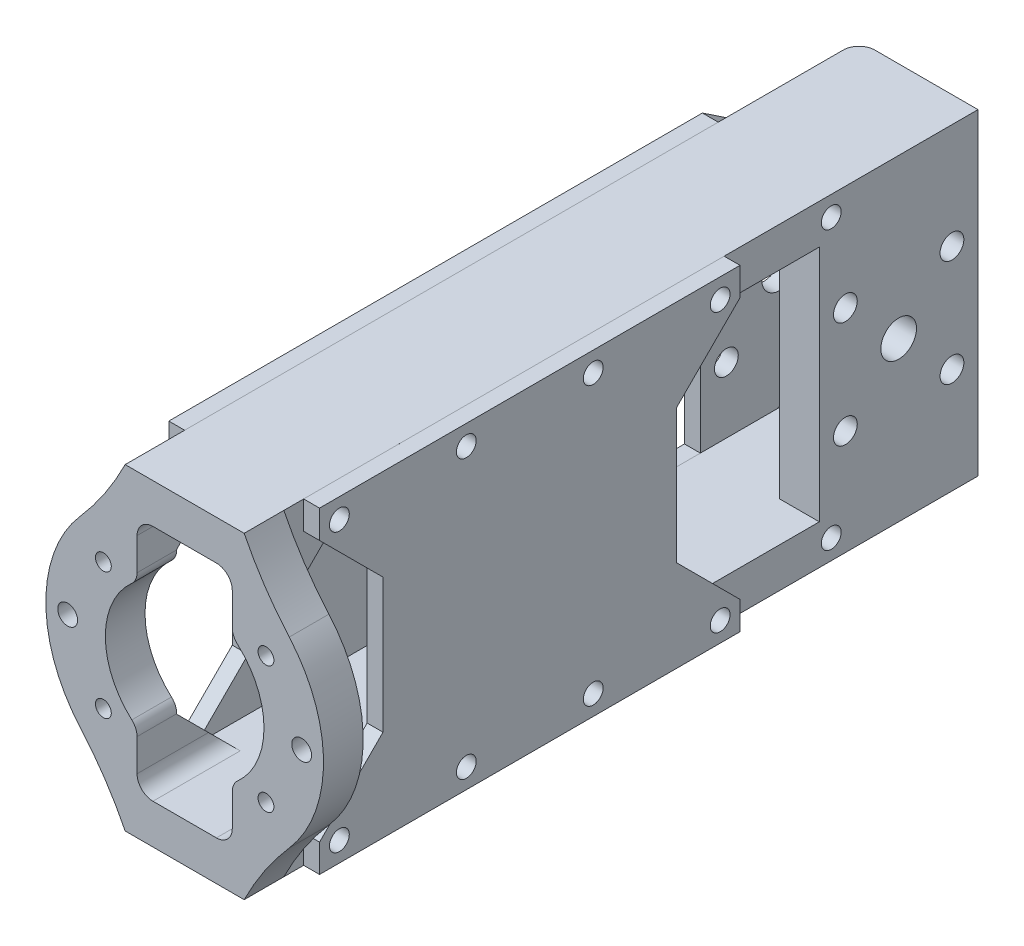
from build123d import *

# Parameters (mm, degrees)
SKETCH_1_R               = 1
SKETCH_1_R_2             = 1.25
SKETCH_1_R_3             = 10
EXTRUDE_1_DEPTH          = 5
EXTRUDE_2_DEPTH          = 7.5
FILLET_2_R               = 40
SKETCH_9_W               = 12
SKETCH_9_H               = 7
CUT_EXTRUDE_2_DEPTH      = 45
FILLET_1_R               = 2
EXTRUDE_START            = 7.5
SKETCH_10_W              = 20
SKETCH_10_H              = 30
SKETCH_10_R              = 1.5
SKETCH_10_R_2            = 2.25
EXTRUDE_3_DEPTH          = 5
CUT_EXTRUDE_3_DEPTH      = 94.173225768
CUT_EXTRUDE_3_DEPTH_BACK = 94.173225768
SKETCH_12_R              = 1.25
SKETCH_13_R              = 1.25
EXTRUDE_4_DEPTH          = 2
EXTRUDE_START_2          = -7.5
SKETCH_14_R              = 1.5
SKETCH_14_R_2            = 2.25
SKETCH_14_R_3            = 1.25
EXTRUDE_5_DEPTH          = 2


with BuildPart() as part:
    # 草图1 → 凸台-拉伸1 (new body)
    # profile 1 of 3: a face of its own
    with BuildSketch(Plane.XY):
        with BuildLine():
            ThreePointArc((7.5, 15.811388301), (0, 17.5), (-7.5, 15.811388301))
            ThreePointArc((-7.5, 15.811388301), (-17.5, 0), (-7.5, -15.811388301))
            ThreePointArc((-7.5, -15.811388301), (0, -17.5), (7.5, -15.811388301))
            ThreePointArc((7.5, -15.811388301), (14.790199458, -9.354143467), (17.5, 0))
            ThreePointArc((17.5, 0), (14.790199458, 9.354143467), (7.5, 15.811388301))
        make_face()
        with Locations((-10.25, -8)):
            Circle(SKETCH_1_R, mode=Mode.SUBTRACT)
        with Locations((10.25, -8)):
            Circle(SKETCH_1_R, mode=Mode.SUBTRACT)
        with Locations((-14.75, 0)):
            Circle(SKETCH_1_R_2, mode=Mode.SUBTRACT)
        with Locations((-10.25, 8)):
            Circle(SKETCH_1_R, mode=Mode.SUBTRACT)
        Circle(SKETCH_1_R_3, mode=Mode.SUBTRACT)
        with Locations((14.75, 0)):
            Circle(SKETCH_1_R_2, mode=Mode.SUBTRACT)
        with Locations((10.25, 8)):
            Circle(SKETCH_1_R, mode=Mode.SUBTRACT)
    # profile 2 of 3: a face of its own
    with BuildSketch(Plane.XY):
        with BuildLine():
            Line((-7.5, 20), (-7.5, 15.811388301))
            ThreePointArc((-7.5, 15.811388301), (0, 17.5), (7.5, 15.811388301))
            Line((7.5, 15.811388301), (7.5, 20))
            Line((7.5, 20), (-7.5, 20))
        make_face()
    # profile 3 of 3: a face of its own
    with BuildSketch(Plane.XY):
        with BuildLine():
            ThreePointArc((7.5, -15.811388301), (0, -17.5), (-7.5, -15.811388301))
            Line((-7.5, -15.811388301), (-7.5, -20))
            Line((-7.5, -20), (7.5, -20))
            Line((7.5, -20), (7.5, -15.811388301))
        make_face()
    extrude(amount=EXTRUDE_1_DEPTH)

    # 草图3 → 凸台-拉伸2 (add, symmetric)
    with BuildSketch(Plane(origin=(0, 0, 0), x_dir=(0, 0, -1), z_dir=(1, 0, 0))):
        Polygon((0, 20), (87.5, 20), (87.5, 15), (6, 15), (0, 9), align=None)
    extrude_2 = extrude(amount=EXTRUDE_2_DEPTH, both=True)

    # 镜向2: 凸台-拉伸2 across plane
    add(extrude_2.mirror(Plane.ZX))

    # 圆角2
    # the kernel refuses this fillet: 40 mm, written as the material it adds along each edge
    with BuildSketch(Plane(origin=(-7.5, 15.811388301, 0), x_dir=(-0.7973311529279393, -0.6035420719142974, 0), z_dir=(0, 0, 1)), Plane(origin=(7.5, -15.811388301, 0), x_dir=(0.79733115292794, 0.6035420719142967, 0), z_dir=(0, 0, 1))) as fillet_2_piece_1:
        with BuildLine():
            CenterArc((15.269376034, -39.162235435), FILLET_2_R, 101.747069775, 14.672077465)
            Line((-2.528003383, -3.339710595), (0, 0))
            ThreePointArc((0, 0), (3.562854408, -0.366521997), (7.125708816, 0))
        make_face()
    extrude(amount=5)
    with BuildSketch(Plane(origin=(7.5, 15.811388301, 0), x_dir=(0, 1, 0), z_dir=(0, 0, 1))) as fillet_2_piece_2:
        with BuildLine():
            CenterArc((22.009559482, -35.810805913), FILLET_2_R, 116.45684946, 14.672077465)
            ThreePointArc((-4.300665063, -5.681549626), (-1.858093125, -3.061986259), (0, 0))
            Line((0, 0), (4.188611699, 0))
        make_face()
    extrude(amount=5)
    with BuildSketch(Plane(origin=(-7.5, -15.811388301, 0), x_dir=(-0.7973311529279405, 0.603542071914296, 0), z_dir=(0, 0, 1))) as fillet_2_piece_3:
        with BuildLine():
            CenterArc((15.269376034, 39.162235435), FILLET_2_R, 243.58085276, 14.672077465)
            Line((-2.528003383, 3.339710595), (0, 0))
            ThreePointArc((0, 0), (3.562854408, 0.366521997), (7.125708816, 0))
        make_face()
    extrude(amount=5)

    # 草图9 → 切除-拉伸2 (cut)
    with BuildSketch(Plane.XY.offset(5)):
        with Locations((0, 11.5)):
            Rectangle(SKETCH_9_W, SKETCH_9_H)
        with Locations((0, -11.5)):
            Rectangle(SKETCH_9_W, SKETCH_9_H)
    extrude(amount=-CUT_EXTRUDE_2_DEPTH, mode=Mode.SUBTRACT)

    # 圆角1
    fillet_1_edges = [part.edges().sort_by_distance(p)[0] for p in [
        (6, -8, 2.5),
        (-6, -15, -0.5),
        (-6, -8, 2.5),
        (6, -15, -0.5),
        (-6, 15, -0.5),
        (-6, 8, 2.5),
        (6, 15, -0.5),
        (6, 8, 2.5),
        (-7.5, 17.5, -87.5),
        (-7.5, -17.5, -87.5),
    ]]
    fillet(fillet_1_edges, radius=FILLET_1_R)

    # 草图10 → 凸台-拉伸3 (add)
    with BuildSketch(Plane(origin=(0, 0, 0), x_dir=(0, 0, -1), z_dir=(1, 0, 0)).offset(EXTRUDE_START)):
        with Locations((77.5, 0)):
            Rectangle(SKETCH_10_W, SKETCH_10_H)
        with Locations(Location((84.217514421, 6.717514421, 0), (0, 0, 270))):
            Circle(SKETCH_10_R, mode=Mode.SUBTRACT)
        with Locations(Location((84.217514421, -6.717514421, 0), (0, 0, 270))):
            Circle(SKETCH_10_R, mode=Mode.SUBTRACT)
        with Locations(Location((70.782485579, -6.717514421, 0), (0, 0, 270))):
            Circle(SKETCH_10_R, mode=Mode.SUBTRACT)
        with Locations(Location((70.782485579, 6.717514421, 0), (0, 0, 270))):
            Circle(SKETCH_10_R, mode=Mode.SUBTRACT)
        with Locations(Location((77.5, 0, 0), (0, 0, 270))):
            Circle(SKETCH_10_R_2, mode=Mode.SUBTRACT)
    extrude(amount=-EXTRUDE_3_DEPTH)

    # 草图12 → 切除-拉伸3 (cut, two sides: drawn at the far end of the back side and taken through both)
    with BuildSketch(Plane.ZY.offset(7.5).offset(-CUT_EXTRUDE_3_DEPTH_BACK)):
        with Locations(Location((-5, 17.5, 0), (0, 0, 270))):
            Circle(SKETCH_12_R)
        with Locations(Location((-21, 17.5, 0), (0, 0, 270))):
            Circle(SKETCH_12_R)
        with Locations(Location((-37, 17.5, 0), (0, 0, 270))):
            Circle(SKETCH_12_R)
        with Locations(Location((-53, 17.5, 0), (0, 0, 270))):
            Circle(SKETCH_12_R)
        with Locations(Location((-69, 17.5, 0), (0, 0, 270))):
            Circle(SKETCH_12_R)
        with Locations(Location((-69, -17.5, 0), (0, 0, 270))):
            Circle(SKETCH_12_R)
        with Locations(Location((-53, -17.5, 0), (0, 0, 270))):
            Circle(SKETCH_12_R)
        with Locations(Location((-37, -17.5, 0), (0, 0, 270))):
            Circle(SKETCH_12_R)
        with Locations(Location((-21, -17.5, 0), (0, 0, 270))):
            Circle(SKETCH_12_R)
        with Locations(Location((-5, -17.5, 0), (0, 0, 270))):
            Circle(SKETCH_12_R)
    extrude(amount=CUT_EXTRUDE_3_DEPTH + CUT_EXTRUDE_3_DEPTH_BACK, mode=Mode.SUBTRACT)


with BuildPart() as body_2:
    # 草图13 → 凸台-拉伸4 (new body)
    with BuildSketch(Plane(origin=(7.5, 0, 0), x_dir=(0, 0, -1), z_dir=(1, 0, 0))):
        Polygon((2.5, 20), (55.5, 20), (55.5, 16.464466094), (47.5, 8.464466094), (47.5, -8.464466094), (55.5, -16.464466094), (55.5, -20), (2.5, -20), (2.5, -16.464466094), (10.5, -8.464466094), (10.5, 8.464466094), (2.5, 16.464466094), align=None)
        with Locations(Location((5, 17.5, 0), (0, 0, 90))):
            Circle(SKETCH_13_R, mode=Mode.SUBTRACT)
        with Locations(Location((21, 17.5, 0), (0, 0, 90))):
            Circle(SKETCH_13_R, mode=Mode.SUBTRACT)
        with Locations(Location((37, 17.5, 0), (0, 0, 90))):
            Circle(SKETCH_13_R, mode=Mode.SUBTRACT)
        with Locations(Location((53, 17.5, 0), (0, 0, 90))):
            Circle(SKETCH_13_R, mode=Mode.SUBTRACT)
        with Locations(Location((53, -17.5, 0), (0, 0, 90))):
            Circle(SKETCH_13_R, mode=Mode.SUBTRACT)
        with Locations(Location((37, -17.5, 0), (0, 0, 90))):
            Circle(SKETCH_13_R, mode=Mode.SUBTRACT)
        with Locations(Location((21, -17.5, 0), (0, 0, 90))):
            Circle(SKETCH_13_R, mode=Mode.SUBTRACT)
        with Locations(Location((5, -17.5, 0), (0, 0, 90))):
            Circle(SKETCH_13_R, mode=Mode.SUBTRACT)
    extrude(amount=EXTRUDE_4_DEPTH)


with BuildPart() as body_3:
    # 草图14 → 凸台-拉伸5 (new body)
    with BuildSketch(Plane(origin=(0, 0, 0), x_dir=(0, 0, -1), z_dir=(1, 0, 0)).offset(EXTRUDE_START_2)):
        Polygon((69.759165658, 20), (2.5, 20), (2.5, 16.464466094), (10.5, 8.464466094), (10.5, -8.464466094), (2.5, -16.464466094), (2.5, -20), (69.759165658, -20), (87.5, -8.130929264), (87.5, 8.130929264), align=None)
        with Locations(Location((84.217514421, -6.717514421, 0), (0, 0, 270))):
            Circle(SKETCH_14_R, mode=Mode.SUBTRACT)
        with Locations(Location((84.217514421, 6.717514421, 0), (0, 0, 270))):
            Circle(SKETCH_14_R, mode=Mode.SUBTRACT)
        with Locations(Location((70.782485579, 6.717514421, 0), (0, 0, 270))):
            Circle(SKETCH_14_R, mode=Mode.SUBTRACT)
        with Locations(Location((77.5, 0, 0), (0, 0, 270))):
            Circle(SKETCH_14_R_2, mode=Mode.SUBTRACT)
        with Locations(Location((70.782485579, -6.717514421, 0), (0, 0, 270))):
            Circle(SKETCH_14_R, mode=Mode.SUBTRACT)
        with Locations(Location((69, -17.5, 0), (0, 0, 270))):
            Circle(SKETCH_14_R_3, mode=Mode.SUBTRACT)
        with Locations(Location((53, -17.5, 0), (0, 0, 270))):
            Circle(SKETCH_14_R_3, mode=Mode.SUBTRACT)
        with Locations(Location((37, -17.5, 0), (0, 0, 270))):
            Circle(SKETCH_14_R_3, mode=Mode.SUBTRACT)
        with Locations(Location((21, -17.5, 0), (0, 0, 270))):
            Circle(SKETCH_14_R_3, mode=Mode.SUBTRACT)
        with Locations(Location((5, -17.5, 0), (0, 0, 270))):
            Circle(SKETCH_14_R_3, mode=Mode.SUBTRACT)
        with Locations(Location((5, 17.5, 0), (0, 0, 270))):
            Circle(SKETCH_14_R_3, mode=Mode.SUBTRACT)
        with Locations(Location((21, 17.5, 0), (0, 0, 270))):
            Circle(SKETCH_14_R_3, mode=Mode.SUBTRACT)
        with Locations(Location((37, 17.5, 0), (0, 0, 270))):
            Circle(SKETCH_14_R_3, mode=Mode.SUBTRACT)
        with Locations(Location((53, 17.5, 0), (0, 0, 270))):
            Circle(SKETCH_14_R_3, mode=Mode.SUBTRACT)
        with Locations(Location((69, 17.5, 0), (0, 0, 270))):
            Circle(SKETCH_14_R_3, mode=Mode.SUBTRACT)
        Polygon((54.035533906, -15), (47.5, -8.464466094), (47.5, 8.464466094), (54.035533906, 15), (67.5, 15), (67.5, -15), align=None, mode=Mode.SUBTRACT)
    extrude(amount=-EXTRUDE_5_DEPTH)


solid = Compound([part.part, body_2.part, body_3.part])
